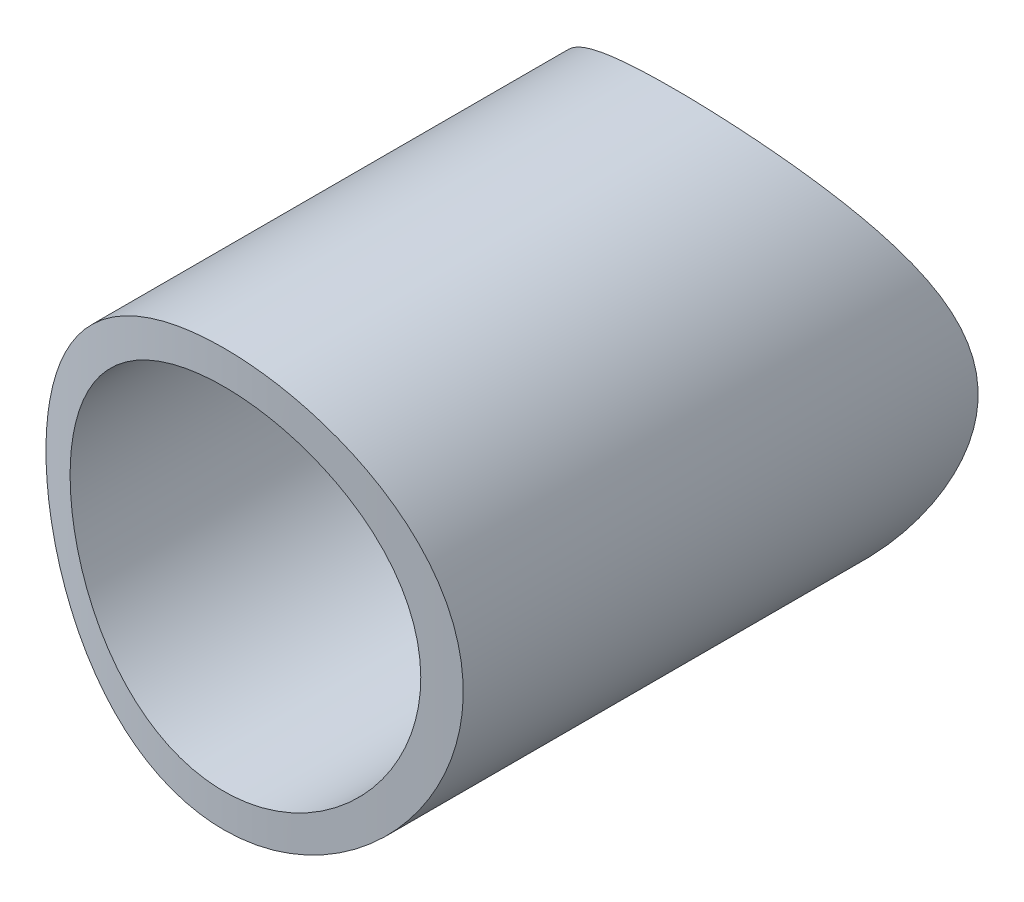
from build123d import *

# Parameters (mm, degrees)
SKETCH1_R               = 12.53
SKETCH1_R_2             = 10.53
BOSS_EXTRUDE1_DEPTH     = 60
CUT_EXTRUDE1_DEPTH      = 63.561983664
CUT_EXTRUDE1_DEPTH_BACK = 63.561983664
SKETCH2_R               = 74.589724577
SKETCH2_R_2             = 43.5
SKETCH2_R_3             = 16.5


with BuildPart() as part:
    # Sketch1 → Boss-Extrude1 (new body)
    with BuildSketch(Plane.XY):
        Circle(SKETCH1_R)
        Circle(SKETCH1_R_2, mode=Mode.SUBTRACT)
    extrude(amount=BOSS_EXTRUDE1_DEPTH)

    # Sketch2 → Cut-Extrude1 (cut, two sides: drawn at the far end of the back side and taken through both)
    # profile 1 of 2: a face of its own
    with BuildSketch(Plane(origin=(0, 0, 0), x_dir=(1, 0, 0), z_dir=(0, 1, 0)).offset(-CUT_EXTRUDE1_DEPTH_BACK)):
        Circle(SKETCH2_R)
        Circle(SKETCH2_R_2, mode=Mode.SUBTRACT)
    # profile 2 of 2: a face of its own
    with BuildSketch(Plane(origin=(0, 0, 0), x_dir=(1, 0, 0), z_dir=(0, 1, 0)).offset(-CUT_EXTRUDE1_DEPTH_BACK)):
        Circle(SKETCH2_R_3)
    extrude(amount=CUT_EXTRUDE1_DEPTH + CUT_EXTRUDE1_DEPTH_BACK, mode=Mode.SUBTRACT)


solid = part.part
